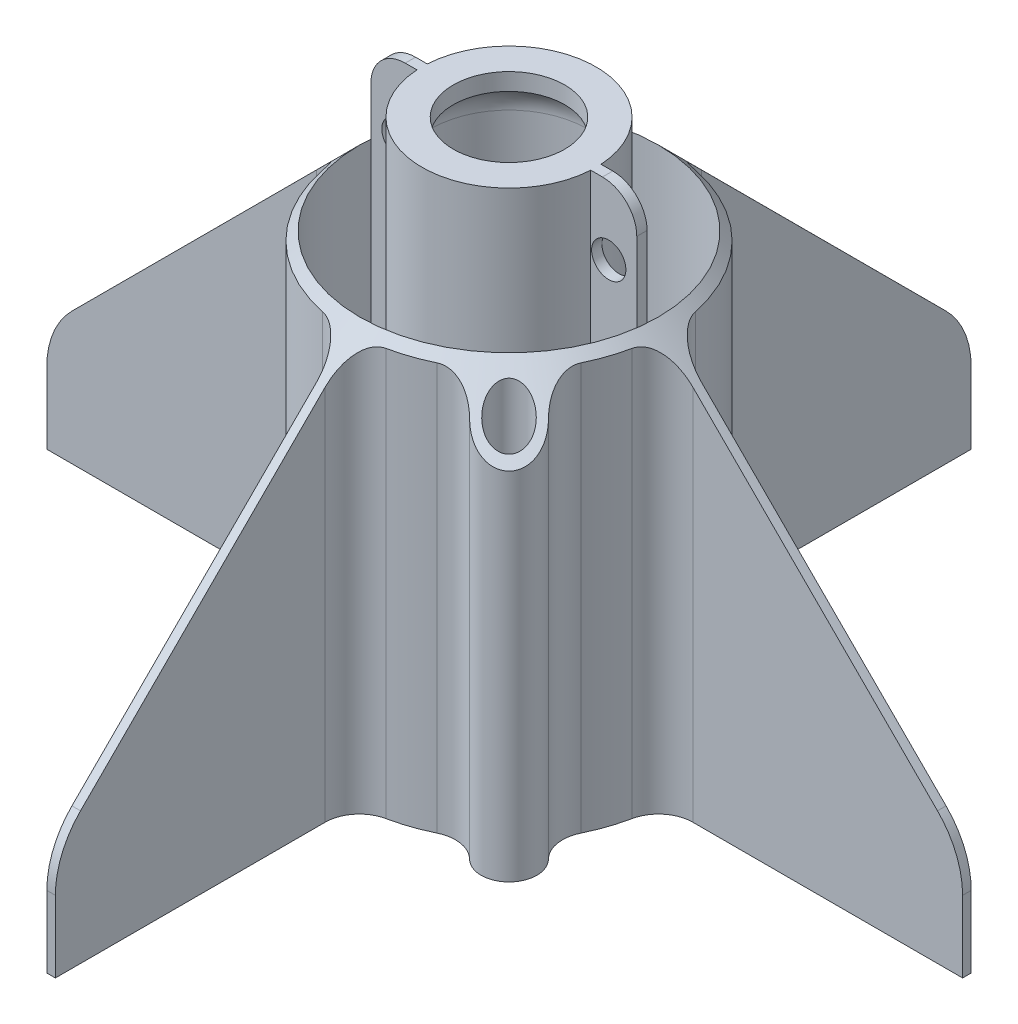
from build123d import *

# Parameters (mm, degrees)
BOSS_EXTRUDE1_DEPTH = 0.5
CIRPATTERN1_COUNT   = 4
BOSS_EXTRUDE3_DEPTH = 50
SKETCH9_R           = 2.25
CUT_EXTRUDE3_DEPTH  = 97.4526827
FILLET2_R           = 4
FILLET3_R           = 6
FILLET4_R           = 6
SKETCH11_W          = 5.85
SKETCH11_H          = 60
BOSS_EXTRUDE4_DEPTH = 0.6
SKETCH12_R          = 2
CUT_EXTRUDE4_DEPTH  = 1.2
FILLET5_R           = 10
FILLET6_R           = 4
FILLET7_R           = 4


with BuildPart() as part:
    # Sketch1 → Revolve2 (revolve)
    with BuildSketch(Plane.XY, mode=Mode.PRIVATE) as revolve2_sk:
        Polygon((6.5, 60), (10.15, 60), (10.15, 1.5), (17.4, 1.5), (17.4, 50), (18.4, 50), (18.4, 0), (9.15, 0), (9.15, 58), (6.5, 58), align=None)
    revolve(revolve2_sk.sketch.rotate(Axis((0, 0, 0), (0, 1, 0)), 90), axis=Axis((0, 0, 0), (0, 1, 0)))

    # Sketch3 → Boss-Extrude1 (add, symmetric)
    with BuildSketch(Plane(origin=(0, 0, 0), x_dir=(0, 0, -1), z_dir=(1, 0, 0))):
        Polygon((-18.4, 50), (-53.4, 50), (-53.4, 0), (-17.9, 0), (-17.9, 50), align=None)
    boss_extrude1 = extrude(amount=BOSS_EXTRUDE1_DEPTH, both=True)

    # CirPattern1: Boss-Extrude1 ×4 about axis
    cirpattern1_axis = Axis((0, 0, 0), (0, 1, 0))
    for i in range(1, CIRPATTERN1_COUNT):
        add(boss_extrude1.rotate(cirpattern1_axis, i * 360 / CIRPATTERN1_COUNT))

    # Sketch8 → Boss-Extrude3 (add)
    with BuildSketch(Plane(origin=(0, 0, 0), x_dir=(1, 0, 0), z_dir=(0, 1, 0))):
        with BuildLine():
            Line((10.359114344, -14.955308422), (12.657211383, -17.253405461))
            ThreePointArc((12.657211383, -17.253405461), (17.253405461, -17.253405461), (17.253405461, -12.657211383))
            Line((17.253405461, -12.657211383), (14.955308422, -10.359114344))
            Line((14.955308422, -10.359114344), (10.359114344, -14.955308422))
        make_face()
    boss_extrude3 = extrude(amount=BOSS_EXTRUDE3_DEPTH)

    # Sketch9 → Cut-Extrude3 (cut, symmetric)
    with BuildSketch(Plane.XZ):
        with Locations(Location((14.955308422, 14.955308422, 0), (0, 0, 270))):
            Circle(SKETCH9_R)
    cut_extrude3 = extrude(amount=CUT_EXTRUDE3_DEPTH, both=True, mode=Mode.SUBTRACT)

    # Mirror2: Boss-Extrude3, Cut-Extrude3 across plane
    add(boss_extrude3.mirror(Plane(origin=(0, 0, 0), x_dir=(-0.7071067811865464, 0, 0.7071067811865487), z_dir=(0.7071067811865487, 0, 0.7071067811865464))))
    add(cut_extrude3.mirror(Plane(origin=(0, 0, 0), x_dir=(-0.7071067811865464, 0, 0.7071067811865487), z_dir=(0.7071067811865487, 0, 0.7071067811865464))), mode=Mode.SUBTRACT)

    # Sketch10 → Cut-Revolve1 (revolve, cut)
    with BuildSketch(Plane.XY, mode=Mode.PRIVATE) as cut_revolve1_sk:
        Polygon((16.393205267, 55), (58.4, 55), (58.4, 7.493205267), (16.393205267, 49.5), align=None)
    revolve(cut_revolve1_sk.sketch.rotate(Axis((0, 60, 0), (0, -1, 0)), 270), axis=Axis((0, 60, 0), (0, -1, 0)), mode=Mode.SUBTRACT)

    # Fillet2
    fillet2_edges = [part.edges().sort_by_distance(p)[0] for p in [
        (-0.5, 23.746602634, 18.393205267),
        (0.5, 23.746602634, 18.393205267),
        (18.393205267, 23.746602634, 0.5),
        (0.5, 23.746602634, -18.393205267),
        (-18.393205267, 23.746602634, 0.5),
        (-18.393205267, 23.746602634, -0.5),
        (-0.5, 23.746602634, -18.393205267),
        (-10.508102632, 23.746602634, -15.104296709),
        (18.393205267, 23.746602634, -0.5),
        (10.508102632, 23.746602634, 15.104296709),
        (15.104296709, 23.746602634, 10.508102632),
        (-15.104296709, 23.746602634, -10.508102632),
    ]]
    fillet(fillet2_edges, radius=FILLET2_R)

    # Fillet3
    fillet3_edges = [part.edges().sort_by_distance(p)[0] for p in [
        (0, 1.5, 17.4),
    ]]
    fillet(fillet3_edges, radius=FILLET3_R)

    # Fillet4
    # the kernel refuses this fillet: 6 mm, written as the material it adds along each edge
    with BuildSketch(Plane(origin=(0, 1.5, 0), x_dir=(0, 0, -1), z_dir=(1, 0, 0))) as fillet4_piece_1:
        with BuildLine():
            CenterArc((16.15, 3.665719575), FILLET4_R, 180, 37.658462006)
            Line((10.15, 3.665719575), (10.03, 3.665719575))
            Line((10.03, 3.665719575), (10.03, 0))
            Line((10.03, 0), (10.15, -0.12))
            ThreePointArc((10.15, -0.12), (10.775, -0.12), (11.305, -0.073314391))
            Line((11.305, -0.073314391), (11.4, 0))
        make_face()
    revolve(axis=Axis((0, 1.5, 0), (0, 1, 0)))

    # Sketch11 → Boss-Extrude4 (add, symmetric)
    with BuildSketch(Plane.XY):
        with Locations((-12.575, 30)):
            Rectangle(SKETCH11_W, SKETCH11_H)
        with Locations((12.575, 30)):
            Rectangle(SKETCH11_W, SKETCH11_H)
    extrude(amount=BOSS_EXTRUDE4_DEPTH, both=True)

    # Sketch12 → Cut-Extrude4 (cut)
    with BuildSketch(Plane(origin=(0, 0, -0.6), x_dir=(-1, 0, 0), z_dir=(0, 0, -1))):
        with Locations((12.23225049, 52)):
            Circle(SKETCH12_R)
        with Locations((-12.23225049, 52)):
            Circle(SKETCH12_R)
    extrude(amount=-CUT_EXTRUDE4_DEPTH, mode=Mode.SUBTRACT)

    # Fillet5
    fillet5_edges = [part.edges().sort_by_distance(p)[0] for p in [
        (-53.4, 12.493205267, 0),
        (0, 12.493205267, 53.4),
        (53.4, 12.493205267, 0),
        (0.250002739, 12.492620052, -53.4),
    ]]
    fillet(fillet5_edges, radius=FILLET5_R)

    # Fillet6
    # the kernel refuses this fillet: 4 mm, written as the material it adds along each edge
    with BuildSketch(Plane(origin=(0, 58, 0), x_dir=(0, 0, -1), z_dir=(1, 0, 0))) as fillet6_piece_1:
        with BuildLine():
            CenterArc((5.15, -3.765302113), FILLET6_R, 0, 70.275366441)
            Line((6.5, 0), (6.527, 0.075306042))
            ThreePointArc((6.527, 0.075306042), (7.825, 0.08), (9.15, 0.08))
            Line((9.15, 0.08), (9.23, 0))
            Line((9.23, 0), (9.23, -3.765302113))
            Line((9.23, -3.765302113), (9.15, -3.765302113))
        make_face()
    revolve(axis=Axis((0, 58, 0), (0, 1, 0)))

    # Fillet7
    fillet7_edges = [part.edges().sort_by_distance(p)[0] for p in [
        (-15.5, 60, 0),
        (15.5, 60, 0),
    ]]
    fillet(fillet7_edges, radius=FILLET7_R)


solid = part.part
